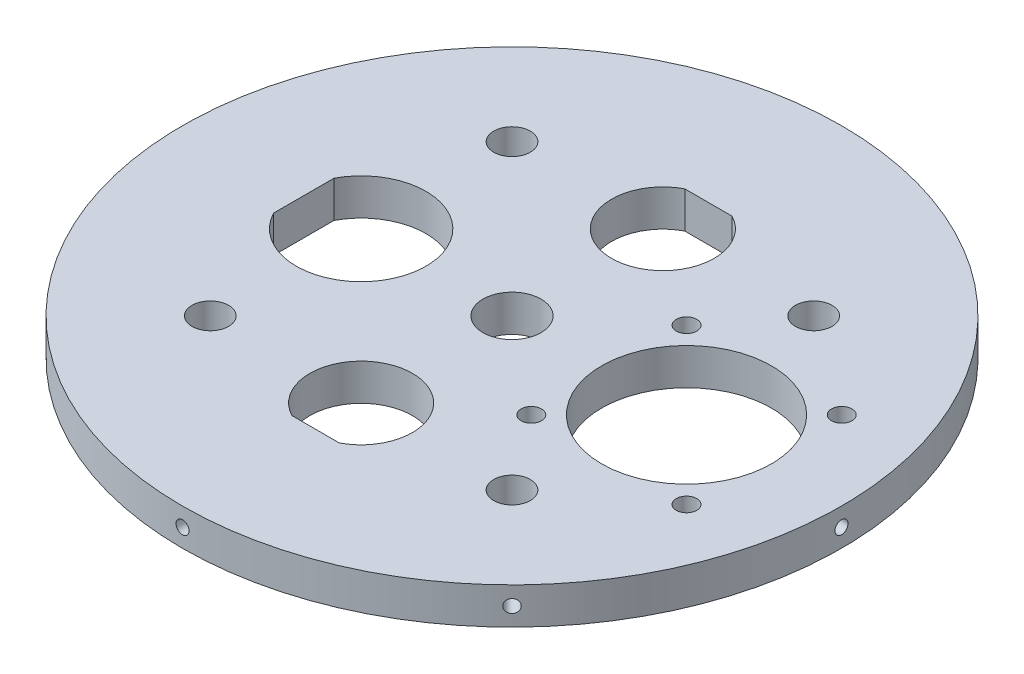
from build123d import *

# Parameters (mm, degrees)
SKETCH2_R           = 57.15
BOSS_EXTRUDE1_DEPTH = 6.35
CUT_EXTRUDE1_REACH  = 83.071
SKETCH6_R           = 3.175
SKETCH7_R           = 14.732
SKETCH7_R_2         = 1.778
CUT_EXTRUDE2_DEPTH  = 82.071372876
SKETCH8_R           = 5.042
CUT_EXTRUDE3_DEPTH  = 82.071372876
CIRPATTERN1_COUNT   = 8


with BuildPart() as part:
    # Sketch2 → Boss-Extrude1 (new body)
    with BuildSketch(Plane(origin=(0, 0, 0), x_dir=(1, 0, 0), z_dir=(0, 1, 0))):
        Circle(SKETCH2_R)
    extrude(amount=BOSS_EXTRUDE1_DEPTH)

    # Sketch6 → Cut-Extrude1 (cut, up to next)
    with BuildSketch(Plane(origin=(0, 6.35, 0), x_dir=(1, 0, 0), z_dir=(0, 1, 0)), mode=Mode.PRIVATE) as cut_extrude1_sk1:
        with Locations((-26.1629, -26.1629)):
            Circle(SKETCH6_R)
    cut_extrude1_tool1 = extrude(cut_extrude1_sk1.sketch, amount=-CUT_EXTRUDE1_REACH, mode=Mode.PRIVATE) & part.part
    # Sketch6 → Cut-Extrude1 (cut, up to next)
    with BuildSketch(Plane(origin=(0, 6.35, 0), x_dir=(1, 0, 0), z_dir=(0, 1, 0)), mode=Mode.PRIVATE) as cut_extrude1_sk2:
        with Locations((26.1629, -26.1629)):
            Circle(SKETCH6_R)
    cut_extrude1_tool2 = extrude(cut_extrude1_sk2.sketch, amount=-CUT_EXTRUDE1_REACH, mode=Mode.PRIVATE) & part.part
    # Sketch6 → Cut-Extrude1 (cut, up to next)
    with BuildSketch(Plane(origin=(0, 6.35, 0), x_dir=(1, 0, 0), z_dir=(0, 1, 0)), mode=Mode.PRIVATE) as cut_extrude1_sk3:
        with Locations((-26.1629, 26.163103615)):
            Circle(SKETCH6_R)
    cut_extrude1_tool3 = extrude(cut_extrude1_sk3.sketch, amount=-CUT_EXTRUDE1_REACH, mode=Mode.PRIVATE) & part.part
    # Sketch6 → Cut-Extrude1 (cut, up to next)
    with BuildSketch(Plane(origin=(0, 6.35, 0), x_dir=(1, 0, 0), z_dir=(0, 1, 0)), mode=Mode.PRIVATE) as cut_extrude1_sk4:
        with Locations((26.1629, 26.163103615)):
            Circle(SKETCH6_R)
    cut_extrude1_tool4 = extrude(cut_extrude1_sk4.sketch, amount=-CUT_EXTRUDE1_REACH, mode=Mode.PRIVATE) & part.part
    add(cut_extrude1_tool1.solids().sort_by_distance((-26.1629, 6.35, 26.1629))[0], mode=Mode.SUBTRACT)
    add(cut_extrude1_tool2.solids().sort_by_distance((26.1629, 6.35, 26.1629))[0], mode=Mode.SUBTRACT)
    add(cut_extrude1_tool3.solids().sort_by_distance((-26.1629, 6.35, -26.163104))[0], mode=Mode.SUBTRACT)
    add(cut_extrude1_tool4.solids().sort_by_distance((26.1629, 6.35, -26.163104))[0], mode=Mode.SUBTRACT)

    # Sketch7 → Cut-Extrude2 (cut, through all)
    with BuildSketch(Plane(origin=(0, 6.35, 0), x_dir=(1, 0, 0), z_dir=(0, 1, 0))):
        with Locations((30, 0.269903496)):
            Circle(SKETCH7_R)
        with Locations((16.54, -13.194096504)):
            Circle(SKETCH7_R_2)
        with Locations((16.54, 13.729903496)):
            Circle(SKETCH7_R_2)
        with Locations((43.46, 13.729903496)):
            Circle(SKETCH7_R_2)
        with Locations((43.46, -13.194096504)):
            Circle(SKETCH7_R_2)
    extrude(amount=-CUT_EXTRUDE2_DEPTH, mode=Mode.SUBTRACT)

    # Sketch8 → Cut-Extrude3 (cut, through all)
    with BuildSketch(Plane(origin=(0, 6.35, 0), x_dir=(1, 0, 0), z_dir=(0, 1, 0))):
        Circle(SKETCH8_R)
        with BuildLine():
            Line((4.098780306, 34.063103615), (-4.098780306, 34.063103615))
            ThreePointArc((-4.098780306, 34.063103615), (0, 17.263103615), (4.098780306, 34.063103615))
        make_face()
        with BuildLine():
            Line((4.098780306, -34.0629), (-4.098780306, -34.0629))
            ThreePointArc((-4.098780306, -34.0629), (0, -17.2629), (4.098780306, -34.0629))
        make_face()
        with BuildLine():
            Line((-36.1129, 5.249761899), (-36.1129, -5.249761899))
            ThreePointArc((-36.1129, -5.249761899), (-14.9129, 0), (-36.1129, 5.249761899))
        make_face()
    extrude(amount=-CUT_EXTRUDE3_DEPTH, mode=Mode.SUBTRACT)

    # Sketch16 → #4-40 Tapped Hole2 (revolve, cut)
    with BuildSketch(Plane(origin=(0, 3.175, -57.15), x_dir=(0, 1, 0), z_dir=(1, 0, 0))):
        Polygon((0, 0), (0, 10.679152758), (1.1303, 10), (1.1303, 0), align=None)
    f_4_40_tapped_hole2 = revolve(axis=Axis((0, 3.175, -63.5), (0, 0, 1)), mode=Mode.SUBTRACT)

    # CirPattern1: #4-40 Tapped Hole2 ×8 about axis
    cirpattern1_axis = Axis((0, 0, 0), (0, 1, 0))
    for i in range(1, CIRPATTERN1_COUNT):
        add(f_4_40_tapped_hole2.rotate(cirpattern1_axis, i * 360 / CIRPATTERN1_COUNT), mode=Mode.SUBTRACT)


solid = part.part
